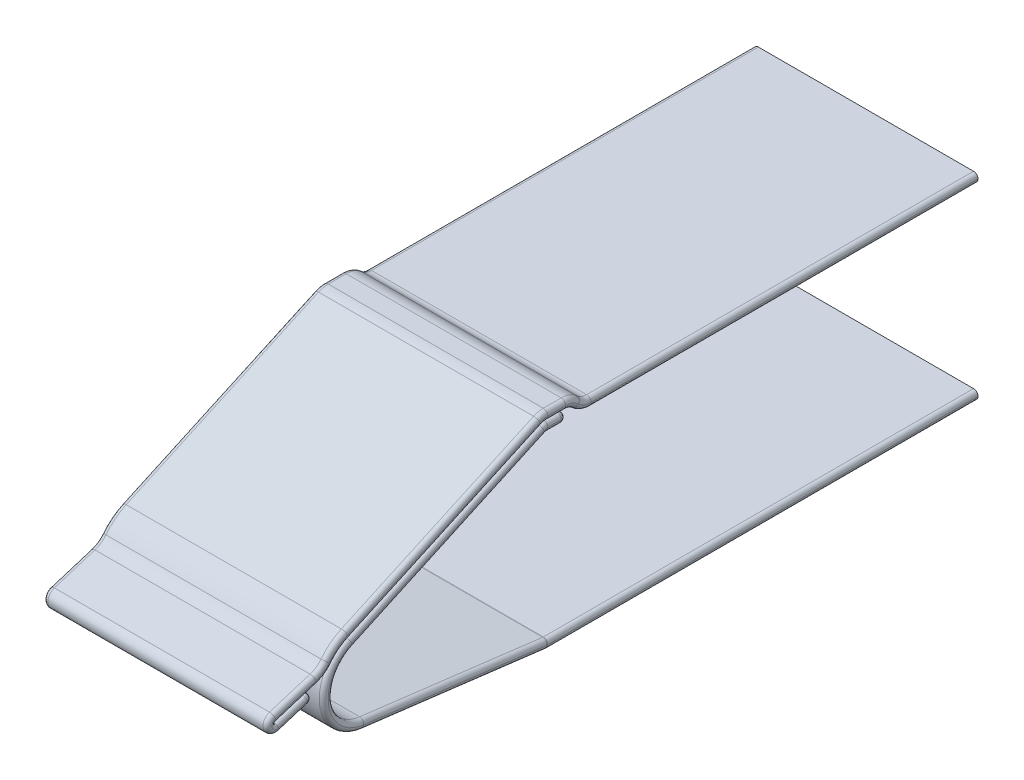
from build123d import *

# Parameters (mm, degrees)
EXTRUDE_THIN1_DEPTH   = 12.5
EXTRUDE_THIN1_2_DEPTH = 12.5
FILLET1_R             = 0.5
FILLET2_R             = 0.5


# Some blends are built 0.0001 mm under size
with BuildPart() as part:
    # Sketch1 → Extrude-Thin1 (new, symmetric)
    with BuildSketch(Plane(origin=(0, 0, 0), x_dir=(0, 0, -1), z_dir=(1, 0, 0))):
        with BuildLine():
            Line((-6e-17, 0.5), (-48, 0.49999999999999417))
            ThreePointArc((-48.00000000000095, 0.4999999999999942), (-48.030741146057345, 0.5009459128115404), (-48.0613659783381, 0.5037800722428256))
            Line((-48.06136597832734, 0.5037800722422212), (-68.49092782661866, 3.030240577937809))
            ThreePointArc((-68.49092782661867, 3.030240577937811), (-71.95325077606414, 6.390239143967806), (-69.66426822892038, 10.637335736800535))
            Line((-69.66426822892036, 10.637335736800534), (-48.20803352861504, 20.45466696710007))
            ThreePointArc((-48.208033528616056, 20.454666967099605), (-48.10645777672469, 20.488535302485293), (-48.000000000000725, 20.499999999999595))
            Line((-48, 20.499999999999993), (-46, 20.499999999999996))
            Line((-46, 20.499999999999996), (-46, 21.499999999999996))
            Line((-46, 21.499999999999996), (-48, 21.499999999999993))
            ThreePointArc((-47.999999999999275, 21.50000000000039), (-48.31937333017057, 21.46560590745754), (-48.62410058584412, 21.36400090130067))
            Line((-48.624100585845135, 21.364000901300205), (-70.08033528615046, 11.546669671000668))
            ThreePointArc((-70.08033528615044, 11.546669671000666), (-72.94156347008014, 6.237798929959755), (-68.6136597832733, 2.037800722422263))
            Line((-68.61365978327332, 2.0378007224222636), (-48.184097934982, -0.4886597832733247))
            ThreePointArc((-48.184097934971234, -0.4886597832739292), (-48.092223438148565, -0.4971622615659719), (-47.99999999999905, -0.5000000000000058))
            Line((-48, -0.5000000000000059), (6e-17, -0.5))
            Line((6e-17, -0.5), (-6e-17, 0.5))
        make_face()
    extrude(amount=EXTRUDE_THIN1_DEPTH, both=True)

    # Fillet2
    # the kernel refuses this fillet: 0.5 mm, written as the material it takes off along each edge
    with BuildSketch(Plane(origin=(12, 20.999999999999996, 46.5), x_dir=(0, 0, -1), z_dir=(0, 1, 1.78e-15))) as fillet2_piece_1_section:
        Polygon((0, 0), (FILLET2_R * 1.02, 0), (FILLET2_R * 1.02, -FILLET2_R * 1.02), (0, -FILLET2_R * 1.02), align=None)
    fillet2_piece_1 = extrude(amount=FILLET2_R * 1.02, mode=Mode.PRIVATE)
    fillet2_piece_1 = fillet2_piece_1 - Plane(origin=(12, 20.999999999999996, 46.5), x_dir=(-0.7071067811865475, 0, 0.7071067811865475), z_dir=(0, 1, 1.78e-15)) * Sphere(FILLET2_R, mode=Mode.PRIVATE)
    with BuildSketch(Plane(origin=(-12, 20.999999999999996, 46.5), x_dir=(0, 1, 1.78e-15), z_dir=(-1, 0, 0))) as fillet2_piece_2_section:
        Polygon((0, 0), (FILLET2_R * 1.02, 0), (FILLET2_R * 1.02, FILLET2_R * 1.02), (-9.1e-16, FILLET2_R * 1.02), align=None)
    fillet2_piece_2 = extrude(amount=FILLET2_R * 1.02, mode=Mode.PRIVATE)
    fillet2_piece_2 = fillet2_piece_2 - Plane(origin=(-12, 20.999999999999996, 46.5), x_dir=(0, -0.7071067811865481, 0.7071067811865469), z_dir=(-1, 0, 0)) * Sphere(FILLET2_R, mode=Mode.PRIVATE)
    with BuildSketch(Plane(origin=(-12, 20.999999999999996, 46.5), x_dir=(0, 0, -1), z_dir=(-1, 0, 0))) as fillet2_piece_3_section:
        Polygon((0, 0), (FILLET2_R * 1.02, 0), (FILLET2_R * 1.02, FILLET2_R * 1.02), (9.1e-16, FILLET2_R * 1.02), align=None)
    fillet2_piece_3 = extrude(amount=FILLET2_R * 1.02, mode=Mode.PRIVATE)
    fillet2_piece_3 = fillet2_piece_3 - Plane(origin=(-12, 20.999999999999996, 46.5), x_dir=(0, 0.7071067811865469, 0.7071067811865481), z_dir=(-1, 0, 0)) * Sphere(FILLET2_R, mode=Mode.PRIVATE)
    with BuildSketch(Plane(origin=(12, 20.999999999999996, 46.5), x_dir=(0, 0, -1), z_dir=(1, 0, 0))) as fillet2_piece_4_section:
        Polygon((0, 0), (FILLET2_R * 1.02, 0), (FILLET2_R * 1.02, -FILLET2_R * 1.02), (9.1e-16, -FILLET2_R * 1.02), align=None)
    fillet2_piece_4 = extrude(amount=FILLET2_R * 1.02, mode=Mode.PRIVATE)
    fillet2_piece_4 = fillet2_piece_4 - Plane(origin=(12, 20.999999999999996, 46.5), x_dir=(0, 0.7071067811865469, 0.7071067811865481), z_dir=(1, 0, 0)) * Sphere(FILLET2_R, mode=Mode.PRIVATE)
    with BuildSketch(Plane(origin=(12.5, 21.499999999999996, 46.5), x_dir=(-1, 0, 0), z_dir=(0, -1.78e-15, 1)), Plane(origin=(12.5, 20.499999999999993, 48), x_dir=(-1, 0, 0), z_dir=(0, 1.78e-15, -1))) as fillet2_piece_5:
        with BuildLine():
            CenterArc((FILLET2_R, FILLET2_R), FILLET2_R, 180, 90)
            Line((0, FILLET2_R), (0, 0))
            Line((0, 0), (FILLET2_R, 0))
        make_face()
    fillet2_piece_5_solid = extrude(amount=1.5, mode=Mode.PRIVATE)
    with BuildSketch(Plane(origin=(-12.5, 19.999999999989686, 47.99999999999873), x_dir=(0, 0.9093339342018172, 0.4160670572264108), z_dir=(0, -0.4160670572264108, 0.9093339342018172))) as fillet2_piece_6:
        with BuildLine():
            CenterArc((0.5000000000099087 + FILLET2_R, -FILLET2_R), FILLET2_R, 90, 90)
            Line((0.5000000000099087 + FILLET2_R, 0), (0.5000000000099087, 0))
            Line((0.5000000000099087, 0), (0.5000000000099087, -FILLET2_R))
        make_face()
    fillet2_piece_6_solid = revolve(axis=Axis((-12.5, 19.999999999989686, 47.99999999999873), (-1, 0, 0)), revolution_arc=24.5865321486199, mode=Mode.PRIVATE)
    with BuildSketch(Plane(origin=(-12.5, 10.637335736800534, 69.66426822892036), x_dir=(1, 2.94e-15, 1.34e-15), z_dir=(0, 0.41606705723008763, -0.9093339342001348))) as fillet2_piece_7:
        with BuildLine():
            CenterArc((FILLET2_R, -FILLET2_R), FILLET2_R, 90.00000000000018, 90)
            Line((1.62e-15, -FILLET2_R), (0, 0))
            Line((0, 0), (FILLET2_R, 0))
        make_face()
    fillet2_piece_7_solid = extrude(amount=23.595550427993853, mode=Mode.PRIVATE)
    with BuildSketch(Plane(origin=(-12.5, 6.999999999999986, 68.00000000000013), x_dir=(0, -0.9924398555155494, 0.12273195665463714), z_dir=(0, -0.12273195665463714, -0.9924398555155494))) as fillet2_piece_8:
        with BuildLine():
            CenterArc((3.9999999999999742 + FILLET2_R, -FILLET2_R), FILLET2_R, 90, 90)
            Line((3.9999999999999742 + FILLET2_R, 0), (3.9999999999999742, 0))
            Line((3.9999999999999742, 0), (3.999999999999974, -FILLET2_R))
        make_face()
    fillet2_piece_8_solid = revolve(axis=Axis((-12.5, 6.999999999999986, 68.00000000000013), (-1, 0, 0)), revolution_arc=148.36366992261483, mode=Mode.PRIVATE)
    with BuildSketch(Plane(origin=(-12.5, 0.5037800722422212, 48.06136597832734), x_dir=(1, 2.2e-16, -3e-17), z_dir=(0, 0.12273195665466374, 0.992439855515546))) as fillet2_piece_9:
        with BuildLine():
            CenterArc((FILLET2_R, -FILLET2_R), FILLET2_R, 89.99999999999999, 90.00000000000001)
            Line((-1.1e-16, -FILLET2_R), (0, 0))
            Line((0, 0), (FILLET2_R, 0))
        make_face()
    fillet2_piece_9_solid = extrude(amount=20.5851888502389, mode=Mode.PRIVATE)
    with BuildSketch(Plane(origin=(12.5, 19.999999999973024, 47.99999999999319), x_dir=(0, 1.0, 4.054830545330327e-12), z_dir=(0, 4.054830545330327e-12, -1.0))) as fillet2_piece_10:
        with BuildLine():
            CenterArc((1.5000000000273666 - FILLET2_R, -FILLET2_R), FILLET2_R, 0, 90)
            Line((1.5000000000273666 - FILLET2_R, 0), (1.5000000000273666, 0))
            Line((1.5000000000273666, 0), (1.5000000000273666, -FILLET2_R))
        make_face()
    fillet2_piece_10_solid = revolve(axis=Axis((12.5, 19.999999999973024, 47.99999999999319), (1, 0, 0)), revolution_arc=24.58653214861313, mode=Mode.PRIVATE)
    with BuildSketch(Plane(origin=(-12.5, 0.99999999996942, 48.000000000007766), x_dir=(0, -1.0, -1.3628209672712064e-11), z_dir=(0, 1.3628209672712064e-11, -1.0))) as fillet2_piece_11:
        with BuildLine():
            CenterArc((0.49999999996942585 + FILLET2_R, -FILLET2_R), FILLET2_R, 89.99999999999994, 90.00000000000006)
            Line((0.49999999996942585 + FILLET2_R, 0), (0.49999999996942585, 0))
            Line((0.49999999996942585, 0), (0.49999999996942585, -FILLET2_R))
        make_face()
    fillet2_piece_11_solid = revolve(axis=Axis((-12.5, 0.99999999996942, 48.000000000007766), (-1, 0, 0)), revolution_arc=7.049797929868709, mode=Mode.PRIVATE)
    with BuildSketch(Plane(origin=(-12.5, 0.5000000000000001, -1.25), x_dir=(1, 0, 0), z_dir=(0, -1.2e-16, 1))) as fillet2_piece_12:
        with BuildLine():
            CenterArc((FILLET2_R, -FILLET2_R), FILLET2_R, 90, 90)
            Line((0, -FILLET2_R), (0, 0))
            Line((0, 0), (FILLET2_R, 0))
        make_face()
    fillet2_piece_12_solid = extrude(amount=49.25, mode=Mode.PRIVATE)
    with BuildSketch(Plane(origin=(-12.5, -0.5000000000000059, 48), x_dir=(1, 0, 0), z_dir=(0, 1.2e-16, -1))) as fillet2_piece_13:
        with BuildLine():
            CenterArc((FILLET2_R, -FILLET2_R), FILLET2_R, 90, 89.99999999999997)
            Line((0, -FILLET2_R), (0, 0))
            Line((0, 0), (FILLET2_R, 0))
        make_face()
    fillet2_piece_13_solid = extrude(amount=49.25, mode=Mode.PRIVATE)
    with BuildSketch(Plane(origin=(-12.5, 0.9999999995876823, 48.000000000019526), x_dir=(0, -0.992439855513871, 0.1227319566682082), z_dir=(0, 0.1227319566682082, 0.992439855513871))) as fillet2_piece_14:
        with BuildLine():
            CenterArc((1.4999999995876883 - FILLET2_R, FILLET2_R), FILLET2_R, 270, 90)
            Line((1.4999999995876883 - FILLET2_R, 0), (1.4999999995876883, 0))
            Line((1.4999999995876883, 0), (1.4999999995876885, FILLET2_R))
        make_face()
    fillet2_piece_14_solid = revolve(axis=Axis((-12.5, 0.9999999995876823, 48.000000000019526), (1, 0, 0)), revolution_arc=7.049797929871855, mode=Mode.PRIVATE)
    with BuildSketch(Plane(origin=(-12.5, 2.0378007224222636, 68.61365978327332), x_dir=(1, -8.7e-16, 1.1e-16), z_dir=(0, -0.12273195665466377, -0.992439855515546))) as fillet2_piece_15:
        with BuildLine():
            CenterArc((FILLET2_R, -FILLET2_R), FILLET2_R, 89.99999999999994, 90.00000000000003)
            Line((-4.4e-16, -FILLET2_R), (0, 0))
            Line((0, 0), (FILLET2_R, 0))
        make_face()
    fillet2_piece_15_solid = extrude(amount=20.5851888502389, mode=Mode.PRIVATE)
    with BuildSketch(Plane(origin=(-12.5, 6.999999999999975, 68.00000000000014), x_dir=(0, 0.9093339342001456, 0.4160670572300639), z_dir=(0, 0.4160670572300639, -0.9093339342001456))) as fillet2_piece_16:
        with BuildLine():
            CenterArc((4.999999999999957 - FILLET2_R, FILLET2_R), FILLET2_R, 270, 90)
            Line((4.999999999999957 - FILLET2_R, 0), (4.999999999999957, 0))
            Line((4.999999999999957, 0), (4.999999999999957, FILLET2_R))
        make_face()
    fillet2_piece_16_solid = revolve(axis=Axis((-12.5, 6.999999999999975, 68.00000000000014), (1, 0, 0)), revolution_arc=148.36366992261517, mode=Mode.PRIVATE)
    with BuildSketch(Plane(origin=(-12.5, 21.364000901300205, 48.624100585845135), x_dir=(1, 0, 0), z_dir=(0, -0.41606705723008763, 0.9093339342001348))) as fillet2_piece_17:
        with BuildLine():
            CenterArc((FILLET2_R, -FILLET2_R), FILLET2_R, 90, 90)
            Line((0, -FILLET2_R), (0, 0))
            Line((0, 0), (FILLET2_R, 0))
        make_face()
    fillet2_piece_17_solid = extrude(amount=23.595550427993853, mode=Mode.PRIVATE)
    with BuildSketch(Plane(origin=(-12.5, 19.999999999973024, 47.99999999999319), x_dir=(0, 1.0, 4.054830545330327e-12), z_dir=(0, 4.054830545330327e-12, -1.0))) as fillet2_piece_18:
        with BuildLine():
            CenterArc((1.5000000000273666 - FILLET2_R, FILLET2_R), FILLET2_R, 270, 90)
            Line((1.5000000000273666 - FILLET2_R, 0), (1.5000000000273666, 0))
            Line((1.5000000000273666, 0), (1.5000000000273666, FILLET2_R))
        make_face()
    fillet2_piece_18_solid = revolve(axis=Axis((-12.5, 19.999999999973024, 47.99999999999319), (1, 0, 0)), revolution_arc=24.58653214861313, mode=Mode.PRIVATE)
    with BuildSketch(Plane(origin=(12.5, 21.364000901300205, 48.624100585845135), x_dir=(-1, 0, 0), z_dir=(0, -0.41606705723008763, 0.9093339342001348))) as fillet2_piece_19:
        with BuildLine():
            CenterArc((FILLET2_R, FILLET2_R), FILLET2_R, 180, 90)
            Line((0, FILLET2_R), (0, 0))
            Line((0, 0), (FILLET2_R, 0))
        make_face()
    fillet2_piece_19_solid = extrude(amount=23.595550427993853, mode=Mode.PRIVATE)
    with BuildSketch(Plane(origin=(-12.5, 21.499999999999996, 46.5), x_dir=(1, 0, 0), z_dir=(0, -1.78e-15, 1)), Plane(origin=(-12.5, 20.499999999999993, 48), x_dir=(1, 0, 0), z_dir=(0, 1.78e-15, -1))) as fillet2_piece_20:
        with BuildLine():
            CenterArc((FILLET2_R, -FILLET2_R), FILLET2_R, 90, 90)
            Line((0, -FILLET2_R), (0, 0))
            Line((0, 0), (FILLET2_R, 0))
        make_face()
    fillet2_piece_20_solid = extrude(amount=1.5, mode=Mode.PRIVATE)
    with BuildSketch(Plane(origin=(12.5, 6.999999999999975, 68.00000000000014), x_dir=(0, 0.9093339342001456, 0.4160670572300639), z_dir=(0, 0.4160670572300639, -0.9093339342001456))) as fillet2_piece_21:
        with BuildLine():
            CenterArc((4.999999999999957 - FILLET2_R, -FILLET2_R), FILLET2_R, 0, 90)
            Line((4.999999999999957 - FILLET2_R, 0), (4.999999999999957, 0))
            Line((4.999999999999957, 0), (4.999999999999957, -FILLET2_R))
        make_face()
    fillet2_piece_21_solid = revolve(axis=Axis((12.5, 6.999999999999975, 68.00000000000014), (1, 0, 0)), revolution_arc=148.36366992261517, mode=Mode.PRIVATE)
    with BuildSketch(Plane(origin=(12.5, 2.0378007224222636, 68.61365978327332), x_dir=(-1, -8.7e-16, 1.1e-16), z_dir=(0, -0.12273195665466377, -0.992439855515546))) as fillet2_piece_22:
        with BuildLine():
            CenterArc((FILLET2_R, FILLET2_R), FILLET2_R, 180.00000000000003, 90)
            Line((-4.4e-16, FILLET2_R), (0, 0))
            Line((0, 0), (FILLET2_R, 0))
        make_face()
    fillet2_piece_22_solid = extrude(amount=20.5851888502389, mode=Mode.PRIVATE)
    with BuildSketch(Plane(origin=(-12, 21.499999999999996, 46), x_dir=(0, 0, 1), z_dir=(1, 0, 0))) as fillet2_piece_23:
        with BuildLine():
            CenterArc((FILLET2_R, FILLET2_R), FILLET2_R, 180, 90)
            Line((0, FILLET2_R), (0, 0))
            Line((0, 0), (FILLET2_R, 0))
        make_face()
    fillet2_piece_23_solid = extrude(amount=24, mode=Mode.PRIVATE)
    with BuildSketch(Plane(origin=(-12, 20.499999999999996, 46), x_dir=(0, 1, 0), z_dir=(1, 0, 0))) as fillet2_piece_24:
        with BuildLine():
            CenterArc((FILLET2_R, FILLET2_R), FILLET2_R, 180, 90)
            Line((0, FILLET2_R), (0, 0))
            Line((0, 0), (FILLET2_R, 0))
        make_face()
    fillet2_piece_24_solid = extrude(amount=24, mode=Mode.PRIVATE)
    with BuildSketch(Plane(origin=(12.5, 0.9999999995876823, 48.000000000019526), x_dir=(0, -0.992439855513871, 0.1227319566682082), z_dir=(0, 0.1227319566682082, 0.992439855513871))) as fillet2_piece_25:
        with BuildLine():
            CenterArc((1.4999999995876883 - FILLET2_R, -FILLET2_R), FILLET2_R, 0, 89.99999999999997)
            Line((1.4999999995876883 - FILLET2_R, 0), (1.4999999995876883, 0))
            Line((1.4999999995876883, 0), (1.4999999995876885, -FILLET2_R))
        make_face()
    fillet2_piece_25_solid = revolve(axis=Axis((12.5, 0.9999999995876823, 48.000000000019526), (1, 0, 0)), revolution_arc=7.049797929871855, mode=Mode.PRIVATE)
    with BuildSketch(Plane(origin=(12.5, -0.5000000000000059, 48), x_dir=(0, 1, 1.2e-16), z_dir=(0, 1.2e-16, -1))) as fillet2_piece_26:
        with BuildLine():
            CenterArc((FILLET2_R, -FILLET2_R), FILLET2_R, 90, 90)
            Line((-3.3e-16, -FILLET2_R), (0, 0))
            Line((0, 0), (FILLET2_R, 0))
        make_face()
    fillet2_piece_26_solid = extrude(amount=49.25, mode=Mode.PRIVATE)
    with BuildSketch(Plane(origin=(12.5, 0.5000000000000001, -1.25), x_dir=(-1, 0, 0), z_dir=(0, -1.2e-16, 1))) as fillet2_piece_27:
        with BuildLine():
            CenterArc((FILLET2_R, FILLET2_R), FILLET2_R, 180, 90)
            Line((0, FILLET2_R), (0, 0))
            Line((0, 0), (FILLET2_R, 0))
        make_face()
    fillet2_piece_27_solid = extrude(amount=49.25, mode=Mode.PRIVATE)
    with BuildSketch(Plane(origin=(12.5, 0.99999999996942, 48.000000000007766), x_dir=(0, -1.0, -1.3628209672712064e-11), z_dir=(0, 1.3628209672712064e-11, -1.0))) as fillet2_piece_28:
        with BuildLine():
            CenterArc((0.49999999996942585 + FILLET2_R, FILLET2_R), FILLET2_R, 180, 90.00000000000006)
            Line((0.49999999996942585 + FILLET2_R, 0), (0.49999999996942585, 0))
            Line((0.49999999996942585, 0), (0.49999999996942585, FILLET2_R))
        make_face()
    fillet2_piece_28_solid = revolve(axis=Axis((12.5, 0.99999999996942, 48.000000000007766), (-1, 0, 0)), revolution_arc=7.049797929868709, mode=Mode.PRIVATE)
    with BuildSketch(Plane(origin=(12.5, 0.5037800722422212, 48.06136597832734), x_dir=(-1, 2.2e-16, -3e-17), z_dir=(0, 0.12273195665466374, 0.992439855515546))) as fillet2_piece_29:
        with BuildLine():
            CenterArc((FILLET2_R, FILLET2_R), FILLET2_R, 180, 90)
            Line((-1.1e-16, FILLET2_R), (0, 0))
            Line((0, 0), (FILLET2_R, 0))
        make_face()
    fillet2_piece_29_solid = extrude(amount=20.5851888502389, mode=Mode.PRIVATE)
    with BuildSketch(Plane(origin=(12.5, 6.999999999999986, 68.00000000000013), x_dir=(0, -0.9924398555155494, 0.12273195665463714), z_dir=(0, -0.12273195665463714, -0.9924398555155494))) as fillet2_piece_30:
        with BuildLine():
            CenterArc((3.9999999999999742 + FILLET2_R, FILLET2_R), FILLET2_R, 180, 90)
            Line((3.9999999999999742 + FILLET2_R, 0), (3.9999999999999742, 0))
            Line((3.9999999999999742, 0), (3.999999999999974, FILLET2_R))
        make_face()
    fillet2_piece_30_solid = revolve(axis=Axis((12.5, 6.999999999999986, 68.00000000000013), (-1, 0, 0)), revolution_arc=148.36366992261483, mode=Mode.PRIVATE)
    with BuildSketch(Plane(origin=(12.5, 10.637335736800534, 69.66426822892036), x_dir=(-1, 2.94e-15, 1.34e-15), z_dir=(0, 0.41606705723008763, -0.9093339342001348))) as fillet2_piece_31:
        with BuildLine():
            CenterArc((FILLET2_R, FILLET2_R), FILLET2_R, 179.99999999999983, 90)
            Line((1.62e-15, FILLET2_R), (0, 0))
            Line((0, 0), (FILLET2_R, 0))
        make_face()
    fillet2_piece_31_solid = extrude(amount=23.595550427993853, mode=Mode.PRIVATE)
    with BuildSketch(Plane(origin=(12.5, 19.999999999989686, 47.99999999999873), x_dir=(0, 0.9093339342018172, 0.4160670572264108), z_dir=(0, -0.4160670572264108, 0.9093339342018172))) as fillet2_piece_32:
        with BuildLine():
            CenterArc((0.5000000000099087 + FILLET2_R, FILLET2_R), FILLET2_R, 180, 90)
            Line((0.5000000000099087 + FILLET2_R, 0), (0.5000000000099087, 0))
            Line((0.5000000000099087, 0), (0.5000000000099087, FILLET2_R))
        make_face()
    fillet2_piece_32_solid = revolve(axis=Axis((12.5, 19.999999999989686, 47.99999999999873), (-1, 0, 0)), revolution_arc=24.5865321486199, mode=Mode.PRIVATE)
    add([fillet2_piece_1, fillet2_piece_2, fillet2_piece_3, fillet2_piece_4, fillet2_piece_5_solid, fillet2_piece_6_solid, fillet2_piece_7_solid, fillet2_piece_8_solid, fillet2_piece_9_solid, fillet2_piece_10_solid, fillet2_piece_11_solid, fillet2_piece_12_solid, fillet2_piece_13_solid, fillet2_piece_14_solid, fillet2_piece_15_solid, fillet2_piece_16_solid, fillet2_piece_17_solid, fillet2_piece_18_solid, fillet2_piece_19_solid, fillet2_piece_20_solid, fillet2_piece_21_solid, fillet2_piece_22_solid, fillet2_piece_23_solid, fillet2_piece_24_solid, fillet2_piece_25_solid, fillet2_piece_26_solid, fillet2_piece_27_solid, fillet2_piece_28_solid, fillet2_piece_29_solid, fillet2_piece_30_solid, fillet2_piece_31_solid, fillet2_piece_32_solid], mode=Mode.SUBTRACT)


with BuildPart() as body_2:
    # Sketch1 → Extrude-Thin1 2 (new, symmetric)
    with BuildSketch(Plane(origin=(0, 0, 0), x_dir=(0, 0, -1), z_dir=(1, 0, 0))):
        with BuildLine():
            Line((-4e-17, 21.499999999999996), (-43.16627453693905, 21.499999999999993))
            ThreePointArc((-43.16627453693897, 21.49999999999996), (-43.74527202850361, 21.608436422822653), (-44.245788999057496, 21.919047619047614))
            ThreePointArc((-44.24578899905736, 21.919047619047607), (-45.05912907620752, 22.423790812912895), (-45.999999999999886, 22.6))
            Line((-46, 22.6), (-47.99999999999999, 22.600000000000005))
            ThreePointArc((-47.99999999999999, 22.600000000000005), (-48.55358043896399, 22.540383572926814), (-49.08177434879828, 22.36426822892034))
            Line((-49.081774348798234, 22.364268228920352), (-70.53800904910355, 12.546936998620811))
            ThreePointArc((-70.53800904910364, 12.546936998620774), (-71.77553792568986, 11.791170355108916), (-72.79971888173911, 10.764664481235709))
            ThreePointArc((-72.79971888173904, 10.764664481235728), (-73.34661418984537, 10.25012820839847), (-74.02163268962676, 9.921202564754132))
            Line((-74.02163268962677, 9.921202564754127), (-78.54586684514922, 8.508426917237665))
            ThreePointArc((-78.54586684515034, 8.508426917237312), (-79.23515954765756, 7.193179575378035), (-77.9199122058007, 6.503886872870186))
            Line((-77.91991220579919, 6.503886872869353), (-74.22283331462928, 7.658368017046303))
            Line((-74.22283331462928, 7.658368017046303), (-74.52090695241502, 8.612910895316936))
            Line((-74.52090695241502, 8.612910895316936), (-78.21798584358493, 7.458429751139986))
            ThreePointArc((-78.21798584358342, 7.458429751139153), (-78.28061666938693, 7.4912532131637555), (-78.24779320736236, 7.553884038967386))
            Line((-78.24779320736349, 7.553884038967033), (-73.72355905184104, 8.966659686483494))
            ThreePointArc((-73.72355905184105, 8.966659686483489), (-72.77853315214706, 9.427155587585585), (-72.0128797207982, 10.147506369557775))
            ThreePointArc((-72.01287972079813, 10.147506369557796), (-71.156597282134, 11.005732591976377), (-70.12194199187337, 11.637603064420716))
            Line((-70.12194199187346, 11.637603064420677), (-48.66570729156814, 21.454934294720218))
            ThreePointArc((-48.6657072915681, 21.45493429472023), (-48.34066488551626, 21.563312967954968), (-47.99999999999999, 21.600000000000005))
            Line((-47.99999999999999, 21.600000000000005), (-46, 21.6))
            ThreePointArc((-46.000000000000114, 21.6), (-45.421002508435606, 21.49156357717717), (-44.92048553788168, 21.180952380952395))
            ThreePointArc((-44.92048553788155, 21.180952380952387), (-44.10714546073156, 20.67620918708688), (-43.16627453693913, 20.500000000000025))
            Line((-43.16627453693905, 20.499999999999993), (4e-17, 20.499999999999996))
            Line((4e-17, 20.499999999999996), (-4e-17, 21.499999999999996))
        make_face()
    extrude(amount=EXTRUDE_THIN1_2_DEPTH, both=True)

    # Fillet1
    fillet1_edges = [body_2.edges().sort_by_distance(p)[0] for p in [
        (12.5, 8.035670323228462, 76.36944639799998),
        (12.5, 7.49125321316382, 78.28061666938696),
        (12.5, 8.260271862725263, 75.98567612960227),
        (-12.5, 7.19317957537928, 79.23515954765796),
        (-12.5, 9.214814740995896, 76.283749767388),
        (-12.5, 10.250128208398472, 73.34661418984537),
        (-12.5, 11.791170355108896, 71.77553792568989),
        (-12.5, 17.45560261377058, 59.80989169895089),
        (-12.5, 22.540383572926814, 48.55358043896399),
        (12.5, 9.427155587585581, 72.77853315214706),
        (-12.5, 22.6, 47),
        (-12.5, 22.42379081291288, 45.05912907620748),
        (-12.5, 21.608436422822656, 43.745272028503614),
        (-12.5, 21.499999999999993, 21.583137268469525),
        (-12.5, 20.499999999999993, 21.583137268469525),
        (-12.5, 20.676209187086886, 44.10714546073157),
        (-12.5, 21.49156357717716, 45.42100250843558),
        (-12.5, 21.6, 47),
        (-12.5, 21.563312967954968, 48.34066488551626),
        (12.5, 11.005732591976363, 71.15659728213402),
        (-12.5, 16.546268679570446, 59.3938246417208),
        (-12.5, 11.005732591976363, 71.15659728213402),
        (-12.5, 9.427155587585581, 72.77853315214706),
        (-12.5, 8.260271862725263, 75.98567612960227),
        (-12.5, 7.49125321316382, 78.28061666938696),
        (-12.5, 8.035670323228462, 76.36944639799998),
        (-12.5, 8.13563945618162, 74.37187013352215),
        (-12.5, 7.081127444957828, 76.07137276021425),
        (12.5, 16.546268679570446, 59.3938246417208),
        (12.5, 21.563312967954968, 48.34066488551626),
        (12.5, 21.6, 47),
        (12.5, 21.49156357717716, 45.42100250843558),
        (0, 8.612910895316936, 74.52090695241502),
        (0, 7.658368017046303, 74.22283331462928),
        (12.5, 20.676209187086886, 44.10714546073157),
        (12.5, 7.081127444957828, 76.07137276021425),
        (12.5, 20.499999999999993, 21.583137268469525),
        (12.5, 21.499999999999993, 21.583137268469525),
        (12.5, 21.608436422822656, 43.745272028503614),
        (12.5, 22.42379081291288, 45.05912907620748),
        (12.5, 22.6, 47),
        (12.5, 22.540383572926814, 48.55358043896399),
        (12.5, 17.45560261377058, 59.80989169895089),
        (12.5, 11.791170355108896, 71.77553792568989),
        (12.5, 10.250128208398472, 73.34661418984537),
        (12.5, 8.13563945618162, 74.37187013352215),
        (12.5, 9.214814740995896, 76.283749767388),
        (12.5, 7.19317957537928, 79.23515954765796),
    ]]
    fillet(fillet1_edges, radius=FILLET1_R - 0.0001)  # a hair under: the kernel refuses the full size


solid = Compound([part.part, body_2.part])
